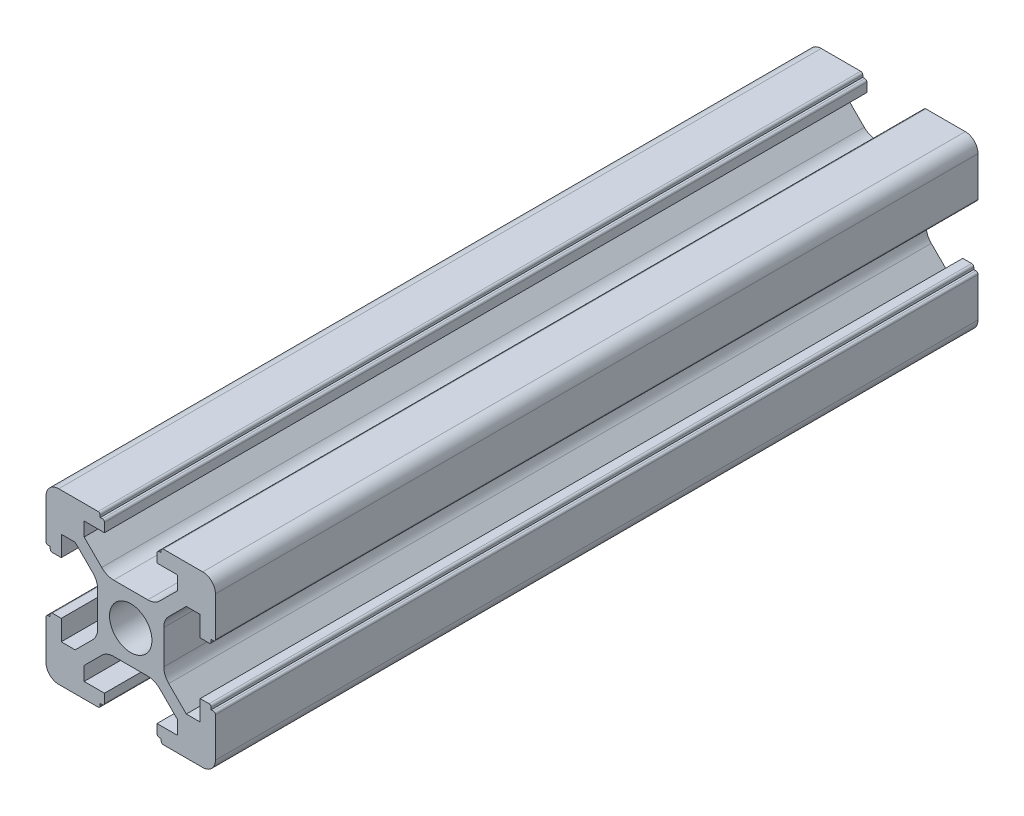
from build123d import *

# Parameters (mm, degrees)
SKETCH1_R           = 2.5
BOSS_EXTRUDE1_DEPTH = 90


with BuildPart() as part:
    # Sketch1 → Boss-Extrude1 (new body)
    with BuildSketch(Plane.XY):
        with BuildLine():
            Line((-8.5, 10), (-3.85, 10))
            ThreePointArc((-3.85, 10), (-3.673223305, 9.926776695), (-3.6, 9.75))
            Line((-3.6, 9.75), (-3.6, 9.5))
            Line((-3.6, 9.5), (-3.35, 9.5))
            ThreePointArc((-3.35, 9.5), (-3.173223305, 9.426776695), (-3.1, 9.25))
            Line((-3.1, 9.25), (-3.1, 8.2))
            Line((-3.1, 8.2), (-5.5, 8.2))
            Line((-5.5, 8.2), (-5.5, 6.560660172))
            Line((-5.5, 6.560660172), (-3.425126266, 4.485786438))
            ThreePointArc((-3.425126266, 4.485786438), (-2.776279568, 4.052240935), (-2.010912703, 3.9))
            Line((-2.010912703, 3.9), (2.010912703, 3.9))
            ThreePointArc((2.010912703, 3.9), (2.776279568, 4.052240935), (3.425126266, 4.485786438))
            Line((3.425126266, 4.485786438), (5.5, 6.560660172))
            Line((5.5, 6.560660172), (5.5, 8.2))
            Line((5.5, 8.2), (3.1, 8.2))
            Line((3.1, 8.2), (3.1, 9.25))
            ThreePointArc((3.1, 9.25), (3.173223305, 9.426776695), (3.35, 9.5))
            Line((3.35, 9.5), (3.6, 9.5))
            Line((3.6, 9.5), (3.6, 9.75))
            ThreePointArc((3.6, 9.75), (3.673223305, 9.926776695), (3.85, 10))
            Line((3.85, 10), (8.5, 10))
            ThreePointArc((8.5, 10), (9.560660172, 9.560660172), (10, 8.5))
            Line((10, 8.5), (10, 3.85))
            ThreePointArc((10, 3.85), (9.926776695, 3.673223305), (9.75, 3.6))
            Line((9.75, 3.6), (9.5, 3.6))
            Line((9.5, 3.6), (9.5, 3.35))
            ThreePointArc((9.5, 3.35), (9.426776695, 3.173223305), (9.25, 3.1))
            Line((9.25, 3.1), (8.2, 3.1))
            Line((8.2, 3.1), (8.2, 5.5))
            Line((8.2, 5.5), (6.560660172, 5.5))
            Line((6.560660172, 5.5), (4.485786438, 3.425126266))
            ThreePointArc((4.485786438, 3.425126266), (4.052240935, 2.776279568), (3.9, 2.010912703))
            Line((3.9, 2.010912703), (3.9, -2.010912703))
            ThreePointArc((3.9, -2.010912703), (4.052240935, -2.776279568), (4.485786438, -3.425126266))
            Line((4.485786438, -3.425126266), (6.560660172, -5.5))
            Line((6.560660172, -5.5), (8.2, -5.5))
            Line((8.2, -5.5), (8.2, -3.1))
            Line((8.2, -3.1), (9.25, -3.1))
            ThreePointArc((9.25, -3.1), (9.426776695, -3.173223305), (9.5, -3.35))
            Line((9.5, -3.35), (9.5, -3.6))
            Line((9.5, -3.6), (9.75, -3.6))
            ThreePointArc((9.75, -3.6), (9.926776695, -3.673223305), (10, -3.85))
            Line((10, -3.85), (10, -8.5))
            ThreePointArc((10, -8.5), (9.560660172, -9.560660172), (8.5, -10))
            Line((8.5, -10), (3.85, -10))
            ThreePointArc((3.85, -10), (3.673223305, -9.926776695), (3.6, -9.75))
            Line((3.6, -9.75), (3.6, -9.5))
            Line((3.6, -9.5), (3.35, -9.5))
            ThreePointArc((3.35, -9.5), (3.173223305, -9.426776695), (3.1, -9.25))
            Line((3.1, -9.25), (3.1, -8.2))
            Line((3.1, -8.2), (5.5, -8.2))
            Line((5.5, -8.2), (5.5, -6.560660172))
            Line((5.5, -6.560660172), (3.425126266, -4.485786438))
            ThreePointArc((3.425126266, -4.485786438), (2.776279568, -4.052240935), (2.010912703, -3.9))
            Line((2.010912703, -3.9), (-2.010912703, -3.9))
            ThreePointArc((-2.010912703, -3.9), (-2.776279568, -4.052240935), (-3.425126266, -4.485786438))
            Line((-3.425126266, -4.485786438), (-5.5, -6.560660172))
            Line((-5.5, -6.560660172), (-5.5, -8.2))
            Line((-5.5, -8.2), (-3.1, -8.2))
            Line((-3.1, -8.2), (-3.1, -9.25))
            ThreePointArc((-3.1, -9.25), (-3.173223305, -9.426776695), (-3.35, -9.5))
            Line((-3.35, -9.5), (-3.6, -9.5))
            Line((-3.6, -9.5), (-3.6, -9.75))
            ThreePointArc((-3.6, -9.75), (-3.673223305, -9.926776695), (-3.85, -10))
            Line((-3.85, -10), (-8.5, -10))
            ThreePointArc((-8.5, -10), (-9.560660172, -9.560660172), (-10, -8.5))
            Line((-10, -8.5), (-10, -3.85))
            ThreePointArc((-10, -3.85), (-9.926776695, -3.673223305), (-9.75, -3.6))
            Line((-9.75, -3.6), (-9.5, -3.6))
            Line((-9.5, -3.6), (-9.5, -3.35))
            ThreePointArc((-9.5, -3.35), (-9.426776695, -3.173223305), (-9.25, -3.1))
            Line((-9.25, -3.1), (-8.2, -3.1))
            Line((-8.2, -3.1), (-8.2, -5.5))
            Line((-8.2, -5.5), (-6.560660172, -5.5))
            Line((-6.560660172, -5.5), (-4.485786438, -3.425126266))
            ThreePointArc((-4.485786438, -3.425126266), (-4.052240935, -2.776279568), (-3.9, -2.010912703))
            Line((-3.9, -2.010912703), (-3.9, 2.010912703))
            ThreePointArc((-3.9, 2.010912703), (-4.052240935, 2.776279568), (-4.485786438, 3.425126266))
            Line((-4.485786438, 3.425126266), (-6.560660172, 5.5))
            Line((-6.560660172, 5.5), (-8.2, 5.5))
            Line((-8.2, 5.5), (-8.2, 3.1))
            Line((-8.2, 3.1), (-9.25, 3.1))
            ThreePointArc((-9.25, 3.1), (-9.426776695, 3.173223305), (-9.5, 3.35))
            Line((-9.5, 3.35), (-9.5, 3.6))
            Line((-9.5, 3.6), (-9.75, 3.6))
            ThreePointArc((-9.75, 3.6), (-9.926776695, 3.673223305), (-10, 3.85))
            Line((-10, 3.85), (-10, 8.5))
            ThreePointArc((-10, 8.5), (-9.560660172, 9.560660172), (-8.5, 10))
        make_face()
        Circle(SKETCH1_R, mode=Mode.SUBTRACT)
    extrude(amount=BOSS_EXTRUDE1_DEPTH)


solid = part.part
